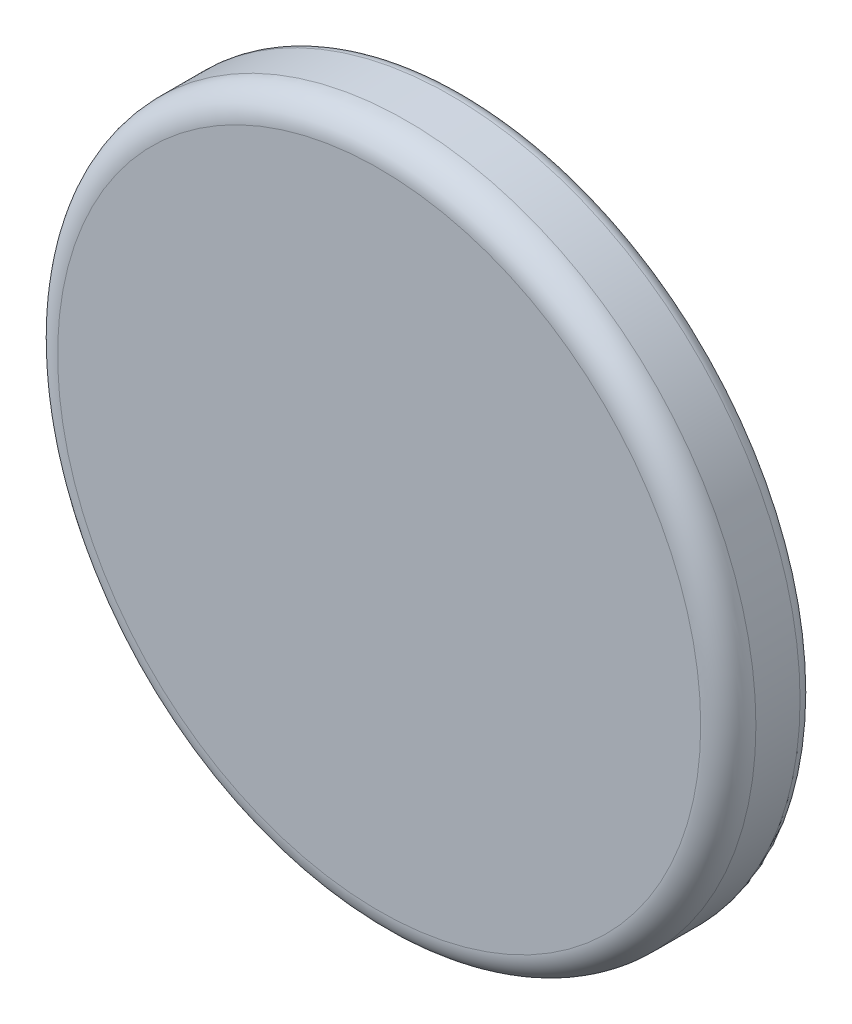
from build123d import *

# Parameters (mm, degrees)
SKETCH_1_R           = 2.4
EXTRUDE_1_DEPTH      = 2.1
EXTRUDE_START        = 1
SKETCH_1_9_R         = 11.65
SKETCH_1_9_R_2       = 2.4
EXTRUDE_2_DEPTH      = 1
EXTRUDE_3_DEPTH      = 1
EXTRUDE_3_DEPTH_BACK = 2.1
SKETCH_1_10_R        = 12.65
SKETCH_1_10_R_2      = 11.65
FILLET_1_R           = 1
FILLET_2_R           = 0.5
FILLET_3_R           = 0.5
FILLET_4_R           = 1


with BuildPart() as part:
    # 草图1 → 凸台-拉伸1 (new body)
    with BuildSketch(Plane.XY):
        Circle(SKETCH_1_R)
        Polygon((0.55, -2), (0.55, -0.55), (2, -0.55), (2, 0.55), (0.55, 0.55), (0.55, 2), (-0.55, 2), (-0.55, 0.55), (-2, 0.55), (-2, -0.55), (-0.55, -0.55), (-0.55, -2), align=None, mode=Mode.SUBTRACT)
    extrude(amount=-EXTRUDE_1_DEPTH)

    # 草图1<9> → 凸台-拉伸2 (add)
    # profile 1 of 3: a face of its own
    with BuildSketch(Plane.XY.offset(EXTRUDE_START)):
        Circle(SKETCH_1_9_R)
        Circle(SKETCH_1_9_R_2, mode=Mode.SUBTRACT)
    # profile 2 of 3: a face of its own
    with BuildSketch(Plane.XY.offset(EXTRUDE_START)):
        Circle(SKETCH_1_9_R_2)
        Polygon((0.55, -2), (0.55, -0.55), (2, -0.55), (2, 0.55), (0.55, 0.55), (0.55, 2), (-0.55, 2), (-0.55, 0.55), (-2, 0.55), (-2, -0.55), (-0.55, -0.55), (-0.55, -2), align=None, mode=Mode.SUBTRACT)
    # profile 3 of 3: a face of its own
    with BuildSketch(Plane.XY.offset(EXTRUDE_START)):
        Polygon((-0.55, -2), (0.55, -2), (0.55, -0.55), (2, -0.55), (2, 0.55), (0.55, 0.55), (0.55, 2), (-0.55, 2), (-0.55, 0.55), (-2, 0.55), (-2, -0.55), (-0.55, -0.55), align=None)
    extrude(amount=-EXTRUDE_2_DEPTH)

    # 草图1<10> → 凸台-拉伸3 (add, two sides: drawn at the far end of the back side and taken through both)
    with BuildSketch(Plane.XY.offset(-EXTRUDE_3_DEPTH_BACK)):
        Circle(SKETCH_1_10_R)
        Circle(SKETCH_1_10_R_2, mode=Mode.SUBTRACT)
    extrude(amount=EXTRUDE_3_DEPTH + EXTRUDE_3_DEPTH_BACK)

    # 圆角1
    fillet_1_edges = [part.edges().sort_by_distance(p)[0] for p in [
        (-12.65, 0, 1),
    ]]
    fillet(fillet_1_edges, radius=FILLET_1_R - 0.0001)  # a hair under: the kernel refuses the full size

    # 圆角2
    fillet_2_edges = [part.edges().sort_by_distance(p)[0] for p in [
        (-11.65, 0, -2.1),
    ]]
    fillet(fillet_2_edges, radius=FILLET_2_R)

    # 圆角3
    fillet_3_edges = [part.edges().sort_by_distance(p)[0] for p in [
        (-12.65, 0, -2.1),
    ]]
    fillet(fillet_3_edges, radius=FILLET_3_R - 0.0001)  # a hair under: the kernel refuses the full size

    # 圆角4
    fillet_4_edges = [part.edges().sort_by_distance(p)[0] for p in [
        (-11.65, 0, 0),
    ]]
    fillet(fillet_4_edges, radius=FILLET_4_R)


solid = part.part
